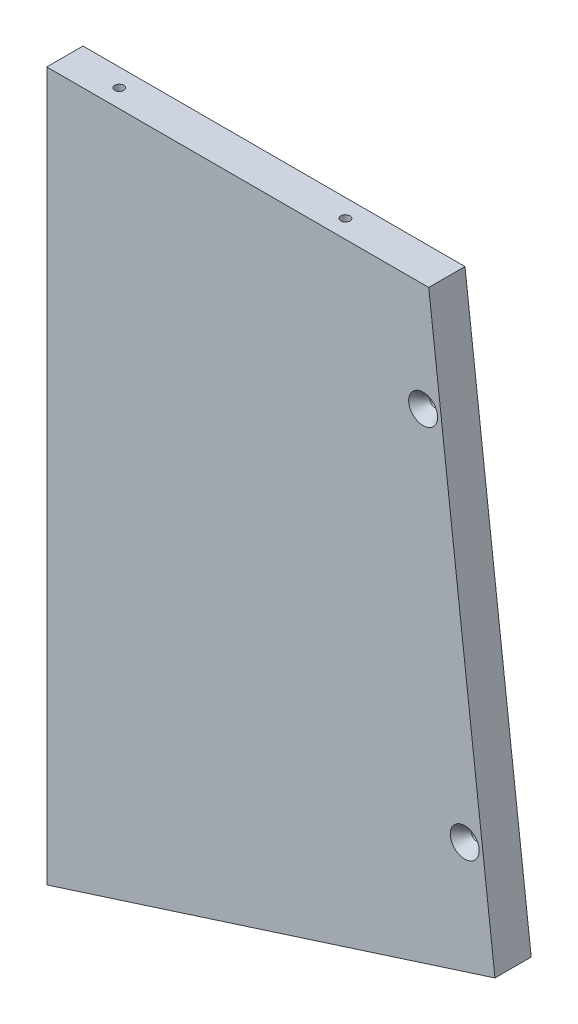
from build123d import *

# Parameters (mm, degrees)
BOSS_EXTRUDE1_DEPTH = 12.7
HOLE3_D             = 3.175
HOLE3_DEPTH         = 31.75
HOLE3_CSINK_D       = 10.16
HOLE3_CSINK_ANGLE   = 82
HOLE3_TIP           = 0.953866233
HOLE6_D             = 3.175
HOLE6_DEPTH         = 38.1
HOLE6_CSINK_D       = 10.16
HOLE6_CSINK_ANGLE   = 82
HOLE6_TIP           = 0.953866233
HOLE7_D             = 3.175
HOLE7_DEPTH         = 31.75
HOLE7_CSINK_D       = 10.16
HOLE7_CSINK_ANGLE   = 82
HOLE7_TIP           = 0.953866233
HOLE8_D             = 3.175
HOLE8_DEPTH         = 31.75
HOLE8_CSINK_D       = 10.16
HOLE8_CSINK_ANGLE   = 82
HOLE8_TIP           = 0.953866233


with BuildPart() as part:
    # Sketch1 → Boss-Extrude1 (new body)
    with BuildSketch(Plane.XY):
        Polygon((-88.190159952, 0), (-222.052967181, 0), (-222.052967181, -248.25), (-64.977416983, -197.966048293), align=None)
    extrude(amount=-BOSS_EXTRUDE1_DEPTH)

    # Hole3
    with Locations(Plane(origin=(-234.752967181, 1090.512770337, -135.816741379), x_dir=(0, 0, -1), z_dir=(-1, 0, 0))):
        with Locations((-129.466741379, 1300.662770337), (-129.466741379, 1128.612770337), (129.198788767, 1128.612770337), (129.198788767, 1300.662770337)):
            CounterSinkHole(HOLE3_D / 2, HOLE3_CSINK_D / 2, depth=HOLE3_DEPTH, counter_sink_angle=HOLE3_CSINK_ANGLE)
            with Locations((0, 0, -(HOLE3_DEPTH + HOLE3_TIP / 2))):  # 118° drill point
                Cone(0, HOLE3_D / 2, HOLE3_TIP, mode=Mode.SUBTRACT)

    # Hole6
    with Locations(Plane(origin=(181.039434513, 1090.512770337, 0), x_dir=(-0.9271838545667885, -0.3746065934159093, 0), z_dir=(0, 0, 1))):
        with Locations((707.166557203, 1065.270372796), (674.127983646, 944.603090451)):
            CounterSinkHole(HOLE6_D / 2, HOLE6_CSINK_D / 2, depth=HOLE6_DEPTH, counter_sink_angle=HOLE6_CSINK_ANGLE)
            with Locations((0, 0, -(HOLE6_DEPTH + HOLE6_TIP / 2))):  # 118° drill point
                Cone(0, HOLE6_D / 2, HOLE6_TIP, mode=Mode.SUBTRACT)

    # Hole7
    with Locations(Plane(origin=(181.039434513, 12.7, -135.816741379), x_dir=(0, 0, -1), z_dir=(0, 1, 0))):
        with Locations((129.198788767, 384.042401694), (-129.466741379, 384.042401694), (-129.466741379, 304.786761906), (-110.416741379, 409.442401694), (-0.133976306, 409.442401694), (110.148788767, 409.442401694), (129.198788767, 304.786761906)):
            CounterSinkHole(HOLE7_D / 2, HOLE7_CSINK_D / 2, depth=HOLE7_DEPTH, counter_sink_angle=HOLE7_CSINK_ANGLE)
            with Locations((0, 0, -(HOLE7_DEPTH + HOLE7_TIP / 2))):  # 118° drill point
                Cone(0, HOLE7_D / 2, HOLE7_TIP, mode=Mode.SUBTRACT)

    # Hole8
    with Locations(Plane(origin=(536.177050645, -18.855816567, -135.816741379), x_dir=(0, 0, 1), z_dir=(0.3048844921716131, -0.9523893355310409, 0))):
        with Locations((-129.257383629, 766.263727577), (129.466741379, 668.242950575), (129.466741379, 766.064256541), (-129.408220012, 668.442537903)):
            CounterSinkHole(HOLE8_D / 2, HOLE8_CSINK_D / 2, depth=HOLE8_DEPTH, counter_sink_angle=HOLE8_CSINK_ANGLE)
            with Locations((0, 0, -(HOLE8_DEPTH + HOLE8_TIP / 2))):  # 118° drill point
                Cone(0, HOLE8_D / 2, HOLE8_TIP, mode=Mode.SUBTRACT)


solid = part.part
